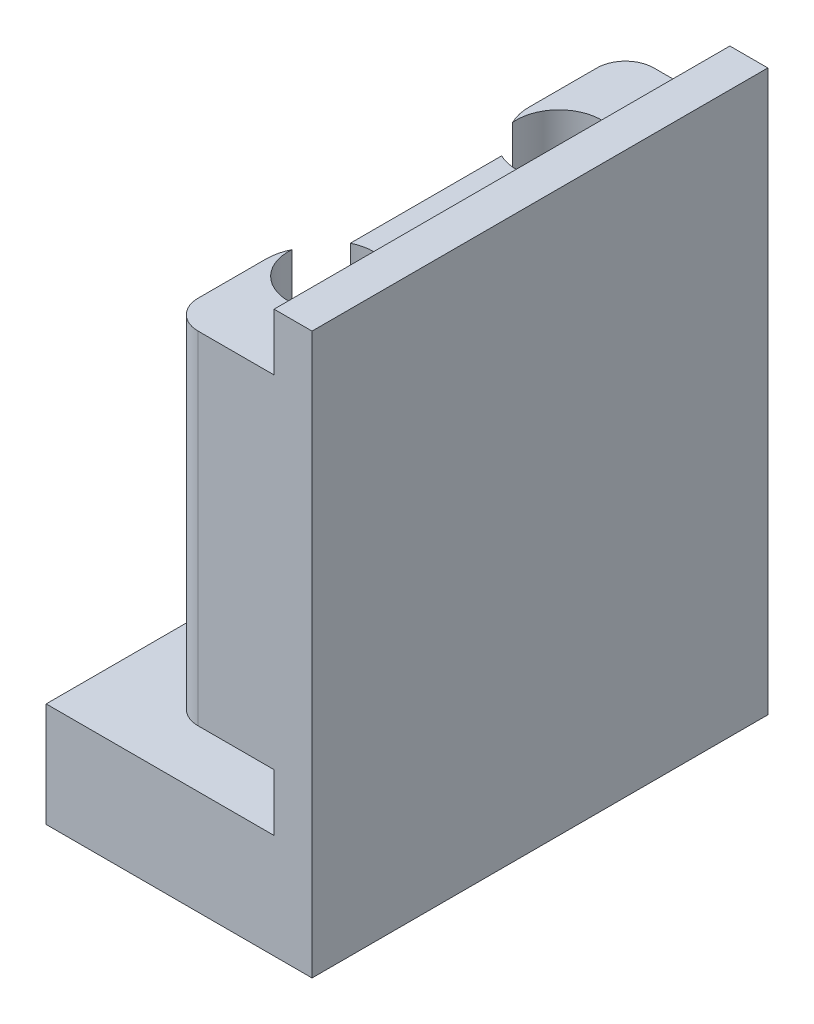
from build123d import *

# Parameters (mm, degrees)
SKETCH1_W           = 12
SKETCH1_H           = 24
BOSS_EXTRUDE1_DEPTH = 5.5
SKETCH2_W           = 2
SKETCH2_H           = 24
BOSS_EXTRUDE2_DEPTH = 29.5
BOSS_EXTRUDE4_START = 3
SKETCH4_W           = 5.5
SKETCH4_H           = 24
BOSS_EXTRUDE4_DEPTH = 18
SKETCH5_W           = 9.25
SKETCH5_H           = 18
CUT_EXTRUDE1_DEPTH  = 1.5
FILLET1_R           = 2.5
SKETCH6_R           = 2.25
CUT_EXTRUDE2_DEPTH  = 31.170349683
FILLET2_R           = 1.5


with BuildPart() as part:
    # Sketch1 → Boss-Extrude1 (new body)
    with BuildSketch(Plane(origin=(0, 0, 0), x_dir=(1, 0, 0), z_dir=(0, 1, 0))):
        Rectangle(SKETCH1_W, SKETCH1_H)
    extrude(amount=BOSS_EXTRUDE1_DEPTH)

    # Sketch2 → Boss-Extrude2 (add)
    with BuildSketch(Plane(origin=(0, 0, 0), x_dir=(1, 0, 0), z_dir=(0, 1, 0))):
        with Locations((7, 0)):
            Rectangle(SKETCH2_W, SKETCH2_H)
    extrude(amount=BOSS_EXTRUDE2_DEPTH)

    # Sketch4 → Boss-Extrude4 (add)
    with BuildSketch(Plane(origin=(0, 5.5, 0), x_dir=(1, 0, 0), z_dir=(0, 1, 0)).offset(BOSS_EXTRUDE4_START)):
        with Locations((3.25, 0)):
            Rectangle(SKETCH4_W, SKETCH4_H)
    extrude(amount=BOSS_EXTRUDE4_DEPTH)

    # Sketch5 → Cut-Extrude1 (cut)
    with BuildSketch(Plane.ZY.offset(-0.5)):
        with Locations((0, 17.5)):
            Rectangle(SKETCH5_W, SKETCH5_H)
    extrude(amount=-CUT_EXTRUDE1_DEPTH, mode=Mode.SUBTRACT)

    # Fillet1
    # the kernel refuses this fillet: 2.5 mm, written as the material it takes off along each edge
    with BuildSketch(Plane(origin=(0.5, 32.228219619, 4.625), x_dir=(0, 0, 1), z_dir=(0, -1, 0)), Plane(origin=(0.5, 8.5, -4.625), x_dir=(0, 0, -1), z_dir=(0, 1, 0))) as fillet1_piece_1:
        with BuildLine():
            CenterArc((2.291287847, -2.5), FILLET1_R, 90, 66.421821522)
            Line((0, -1.5), (0, 0))
            Line((0, 0), (2.291287847, 0))
        make_face()
    extrude(amount=23.728219619, mode=Mode.SUBTRACT)

    # Sketch6 → Cut-Extrude2 (cut, through all)
    with BuildSketch(Plane(origin=(0, 26.5, 0), x_dir=(1, 0, 0), z_dir=(0, 1, 0))):
        with Locations(Location((3, -6, 0), (0, 0, 270))):
            Circle(SKETCH6_R)
        with Locations(Location((3, 6, 0), (0, 0, 270))):
            Circle(SKETCH6_R)
    extrude(amount=-CUT_EXTRUDE2_DEPTH, mode=Mode.SUBTRACT)

    # Fillet2
    fillet2_edges = [part.edges().sort_by_distance(p)[0] for p in [
        (0.5, 17.5, -12),
        (0.5, 17.5, 12),
    ]]
    fillet(fillet2_edges, radius=FILLET2_R)


solid = part.part
